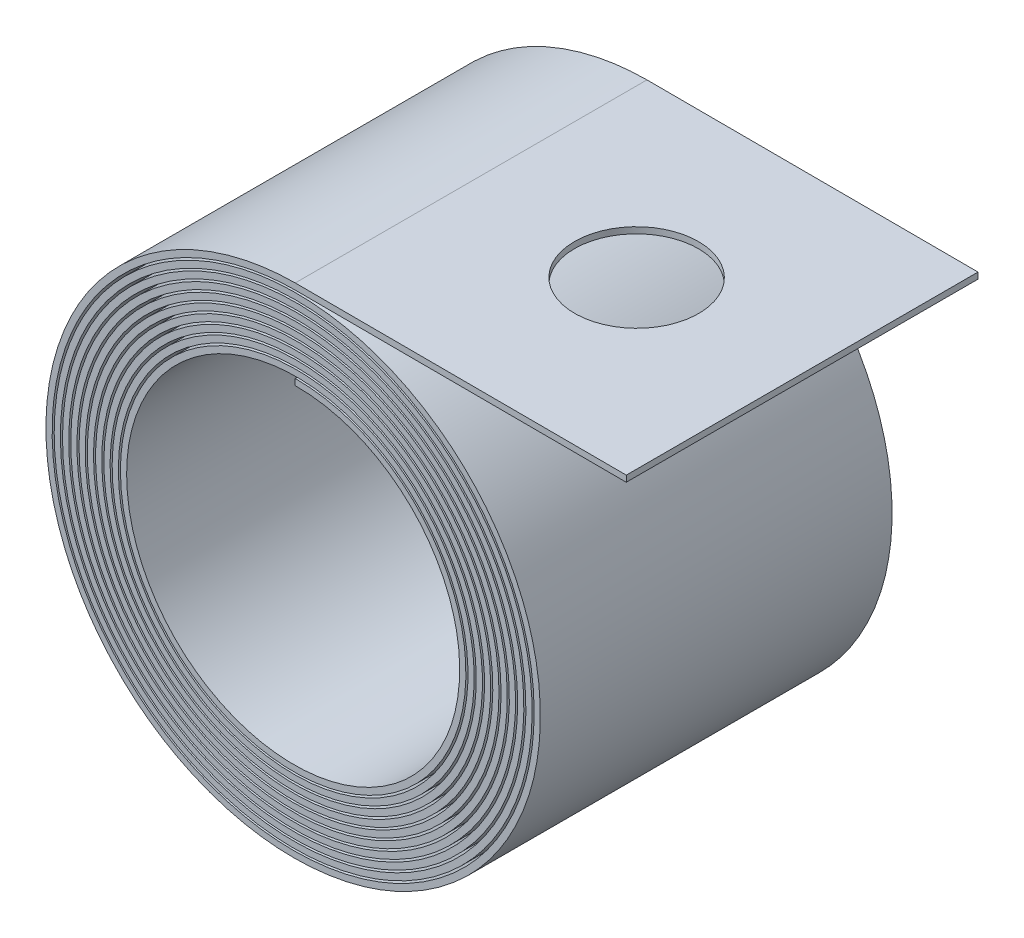
from build123d import *

# Parameters (mm, degrees)
SWEEP_START         = -4.25
SWEEP_1_DEPTH       = 8.5
SKETCH_5_W          = 8.5
SKETCH_5_H          = 0.15
EXTRUDE_2_DEPTH     = 8
SKETCH_6_R          = 1.5
CUT_EXTRUDE_1_DEPTH = 0.15


# Read off the part's stored shape, not the designer's step: 扫描1
with BuildPart() as part:
    # 扫描1 outline → 扫描1 (new body)
    with BuildSketch(Plane.XY.offset(SWEEP_START)):
        with BuildLine():
            Line((0, 4.075), (0, 3.925))
            add(Edge.make_bspline(
                [(0, 3.925), (0.642226637, 3.93020833), (1.286494802, 3.774676224), (2.42870073, 3.175965741), (2.925528499, 2.733324325), (3.653474808, 1.662625143), (3.883865128, 1.035568098), (4.021633544, -0.25694444), (3.928840666, -0.921169227), (3.439098606, -2.130731146), (3.04258066, -2.674897775), (2.036530571, -3.514017167), (1.427934296, -3.808137818), (0.140104167, -4.074923873), (-0.537907272, -4.047295631), (-1.804327217, -3.674016702), (-2.391514545, -3.328684705), (-3.336050383, -2.398880223), (-3.69246868, -1.815267916), (-4.088652425, -0.545109366), (-4.128001563, 0.140235088), (-3.877658288, 1.452189666), (-3.588166195, 2.077538862), (-2.745688207, 3.12052111), (-2.193476478, 3.537132772), (-0.954094753, 4.061776383), (-0.268093509, 4.169270616), (1.077347524, 4.047223284), (1.735498218, 3.817758921), (2.868790088, 3.073045491), (3.34282671, 2.558474902), (3.993655808, 1.362956702), (4.169791679, 0.683132452), (4.180208321, -0.683132452), (4.014439567, -1.368267978), (3.377163029, -2.582625922), (2.906229108, -3.11066966), (1.767505477, -3.884068454), (1.100781564, -4.128651805), (-0.273149335, -4.274439231), (-0.979047726, -4.175464656), (-2.264194363, -3.654414382), (-2.842199798, -3.232799866), (-3.733220371, -2.163508007), (-4.045353743, -1.516827031), (-4.328100589, -0.148756593), (-4.298405145, 0.571333692), (-3.901377357, 1.916043136), (-3.534386419, 2.53936622), (-2.546731899, 3.541752098), (-1.926983834, 3.919829333), (-0.578535786, 4.33976194), (0.148887514, 4.381178278), (1.541082401, 4.114874214), (2.204516298, 3.807369398), (3.310740317, 2.912990231), (3.752448546, 2.326939695), (4.308400375, 1.011973252), (4.422076301, 0.284298404), (4.292009962, -1.142560989), (4.048352565, -1.840378551), (3.258186653, -3.041694872), (2.712400094, -3.544023998), (1.444729879, -4.233419152), (0.724038607, -4.419791678), (-0.724038607, -4.430208322), (-1.450041154, -4.254202911), (-2.736551115, -3.578360318), (-3.295810821, -3.07913389), (-4.114662099, -1.872385812), (-4.373438481, -1.165995029), (-4.527244918, 0.28935423), (-4.422088646, 1.036926225), (-3.869730158, 2.397657581), (-3.423019072, 3.009501821), (-2.290485444, 3.952423574), (-1.605719766, 4.282569667), (-0.15740902, 4.581277304), (0.604760112, 4.549514658), (2.027759055, 4.128738012), (2.687217896, 3.740088133), (3.747453813, 2.694583576), (4.147189987, 2.038699753), (4.590871454, 0.611962206), (4.634354992, -0.15753994), (4.35209014, -1.629975136), (4.026572601, -2.331493733), (3.080292255, -3.500959523), (2.460402912, -3.967764321), (1.069851751, -4.555024366), (0.3005033, -4.674881986), (-1.207774455, -4.53679664), (-1.945258884, -4.27894621), (-3.214599655, -3.443327815), (-3.745221286, -2.866325285), (-4.473182497, -1.526503056), (-4.669791678, -0.764944762), (-4.680208322, 0.764944762), (-4.493966254, 1.531814331), (-3.779557607, 2.890476307), (-3.252038673, 3.480951981), (-1.977266146, 4.345255745), (-1.231208495, 4.618225158), (0.305559126, 4.780050604), (1.094804723, 4.668712637), (2.531120798, 4.085045934), (3.176803844, 3.613238278), (4.171626778, 2.41746288), (4.519785592, 1.6946125), (4.83445402, 0.166061446), (4.800624171, -0.638186532), (4.356098666, -2.139474974), (3.945789847, -2.835069571), (2.842435252, -3.953155528), (2.150415671, -4.37455064), (0.645388627, -4.841980968), (-0.166192366, -4.887531706), (-1.718867871, -4.589306066), (-2.458471169, -4.245775803), (-3.69117873, -3.247594279), (-4.183080096, -2.593866129), (-4.801648357, -1.127730251), (-4.927687672, -0.316708195), (-4.781583318, 1.27298792), (-4.509539854, 2.050139218), (-3.628468976, 3.387504438), (-3.020250477, 3.946418573), (-1.608276233, 4.712945841), (-0.805850916, 4.919791677), (0.805850916, 4.930208323), (1.613587507, 4.733729597), (3.044401499, 3.980754896), (3.666093142, 3.424943455), (4.57584939, 2.08214648), (4.863011835, 1.29642196), (5.032856291, -0.321764021), (4.915336627, -1.152683222), (4.30036171, -2.664584016), (3.803457483, -3.344105868), (2.544440316, -4.390829981), (1.783505235, -4.757001516), (0.174713872, -5.087630736), (-0.671612951, -5.051733684), (-2.251190893, -4.583459321), (-2.982921247, -4.151491562), (-4.158857243, -2.990286928), (-4.601911294, -2.26213159), (-5.093090483, -0.678815047), (-5.140708421, 0.174844792), (-4.826521991, 1.807760606), (-4.464979006, 2.585448604), (-3.414896303, 3.881397936), (-2.727329346, 4.398395871), (-1.18560875, 5.048272349), (-0.33291309, 5.180493357), (1.338201386, 5.026369996), (2.155019551, 4.740133499), (3.560409221, 3.813610138), (4.147615861, 3.174175669), (4.952709185, 1.69004941), (5.169791677, 0.846757071), (5.180208323, -0.846757071), (4.973492941, -1.695360683), (4.181952185, -3.198326691), (3.597848238, -3.851234303), (2.187026814, -4.806443035), (1.361635425, -5.107798512), (-0.337968916, -5.285661977), (-1.210561721, -5.161960617), (-2.798047233, -4.515677486), (-3.511407891, -3.993676689), (-4.610033185, -2.671417752), (-4.994217441, -1.87239797), (-5.340807451, -0.183366299), (-5.302843198, 0.705039371), (-4.810819976, 2.362906812), (-4.357193276, 3.130772923), (-3.138138605, 4.364558958), (-2.373847508, 4.829271947), (-0.712241467, 5.344199997), (0.183497218, 5.393885135), (1.896653341, 5.063737917), (2.71242604, 4.684182209), (4.071617143, 3.582198327), (4.613711646, 2.860792563), (5.29489634, 1.243487249), (5.433299043, 0.349117985), (5.271156674, -1.403414851), (4.970727143, -2.259899885), (3.9987513, -3.733314004), (3.32810086, -4.348813149), (1.771822586, -5.19247253), (0.887663226, -5.419791676), (-0.887663226, -5.430208324), (-1.77713386, -5.213256284), (-3.352251883, -4.383149473), (-4.036375464, -3.77075302), (-5.037036681, -2.291907148), (-5.352585189, -1.42684889), (-5.538467664, 0.354173811), (-5.408584608, 1.26844022), (-4.730993262, 2.93151045), (-4.183895895, 3.678709914), (-2.798395189, 4.829236388), (-1.961290704, 5.231433366), (-0.192018725, 5.593984166), (0.738465791, 5.553952711), (2.47462273, 5.03818063), (3.278624598, 4.56289499), (4.570260673, 3.285990281), (5.056632601, 2.485563427), (5.595309511, 0.745667887), (5.64706185, -0.192149644), (5.300953843, -1.985546075), (4.903385411, -2.839403475), (3.749500351, -4.261836349), (2.99425578, -4.829027421), (1.301365748, -5.541520331), (0.365322881, -5.686104728), (-1.468628316, -5.515943351), (-2.364780218, -5.201320788), (-3.906218787, -4.183892461), (-4.550010437, -3.482026052), (-5.432235874, -1.853595763), (-5.669791676, -0.92856938), (-5.680208324, 0.92856938), (-5.453019628, 1.858907036), (-4.584346762, 3.506177075), (-3.943657803, 4.221516625), (-2.396787482, 5.267630326), (-1.492062356, 5.597371866), (0.370378706, 5.79127335), (1.326318719, 5.655208598), (3.064973667, 4.946309038), (3.846011937, 4.374115101), (5.048439592, 2.925372625), (5.468649291, 2.050183439), (5.847160882, 0.200671151), (5.805062225, -0.771892211), (5.265541284, -2.586338649), (4.768596704, -3.426476274), (3.433841957, -4.775962388), (2.597279345, -5.283993255), (0.779094307, -5.846419025), (-0.20080207, -5.900238564), (-2.07443881, -5.538169768), (-2.966380911, -5.122588614), (-4.452055555, -3.916802375), (-5.044343197, -3.127718997), (-5.788144322, -1.359244248), (-5.938910414, -0.381527776), (-5.760730029, 1.533841782), (-5.431914432, 2.469660552), (-4.369033623, 4.07912357), (-3.635951243, 4.751207725), (-1.93536894, 5.671999218), (-0.969475867, 5.919791664), (0, 5.925)],
                knots=[0, 0, 0, 0, 0.0078125, 0.0078125, 0.015625, 0.015625, 0.0234375, 0.0234375, 0.03125, 0.03125, 0.0390625, 0.0390625, 0.046875, 0.046875, 0.0546875, 0.0546875, 0.0625, 0.0625, 0.0703125, 0.0703125, 0.078125, 0.078125, 0.0859375, 0.0859375, 0.09375, 0.09375, 0.1015625, 0.1015625, 0.109375, 0.109375, 0.1171875, 0.1171875, 0.125, 0.125, 0.1328125, 0.1328125, 0.140625, 0.140625, 0.1484375, 0.1484375, 0.15625, 0.15625, 0.1640625, 0.1640625, 0.171875, 0.171875, 0.1796875, 0.1796875, 0.1875, 0.1875, 0.1953125, 0.1953125, 0.203125, 0.203125, 0.2109375, 0.2109375, 0.21875, 0.21875, 0.2265625, 0.2265625, 0.234375, 0.234375, 0.2421875, 0.2421875, 0.25, 0.25, 0.2578125, 0.2578125, 0.265625, 0.265625, 0.2734375, 0.2734375, 0.28125, 0.28125, 0.2890625, 0.2890625, 0.296875, 0.296875, 0.3046875, 0.3046875, 0.3125, 0.3125, 0.3203125, 0.3203125, 0.328125, 0.328125, 0.3359375, 0.3359375, 0.34375, 0.34375, 0.3515625, 0.3515625, 0.359375, 0.359375, 0.3671875, 0.3671875, 0.375, 0.375, 0.3828125, 0.3828125, 0.390625, 0.390625, 0.3984375, 0.3984375, 0.40625, 0.40625, 0.4140625, 0.4140625, 0.421875, 0.421875, 0.4296875, 0.4296875, 0.4375, 0.4375, 0.4453125, 0.4453125, 0.453125, 0.453125, 0.4609375, 0.4609375, 0.46875, 0.46875, 0.4765625, 0.4765625, 0.484375, 0.484375, 0.4921875, 0.4921875, 0.5, 0.5, 0.5078125, 0.5078125, 0.515625, 0.515625, 0.5234375, 0.5234375, 0.53125, 0.53125, 0.5390625, 0.5390625, 0.546875, 0.546875, 0.5546875, 0.5546875, 0.5625, 0.5625, 0.5703125, 0.5703125, 0.578125, 0.578125, 0.5859375, 0.5859375, 0.59375, 0.59375, 0.6015625, 0.6015625, 0.609375, 0.609375, 0.6171875, 0.6171875, 0.625, 0.625, 0.6328125, 0.6328125, 0.640625, 0.640625, 0.6484375, 0.6484375, 0.65625, 0.65625, 0.6640625, 0.6640625, 0.671875, 0.671875, 0.6796875, 0.6796875, 0.6875, 0.6875, 0.6953125, 0.6953125, 0.703125, 0.703125, 0.7109375, 0.7109375, 0.71875, 0.71875, 0.7265625, 0.7265625, 0.734375, 0.734375, 0.7421875, 0.7421875, 0.75, 0.75, 0.7578125, 0.7578125, 0.765625, 0.765625, 0.7734375, 0.7734375, 0.78125, 0.78125, 0.7890625, 0.7890625, 0.796875, 0.796875, 0.8046875, 0.8046875, 0.8125, 0.8125, 0.8203125, 0.8203125, 0.828125, 0.828125, 0.8359375, 0.8359375, 0.84375, 0.84375, 0.8515625, 0.8515625, 0.859375, 0.859375, 0.8671875, 0.8671875, 0.875, 0.875, 0.8828125, 0.8828125, 0.890625, 0.890625, 0.8984375, 0.8984375, 0.90625, 0.90625, 0.9140625, 0.9140625, 0.921875, 0.921875, 0.9296875, 0.9296875, 0.9375, 0.9375, 0.9453125, 0.9453125, 0.953125, 0.953125, 0.9609375, 0.9609375, 0.96875, 0.96875, 0.9765625, 0.9765625, 0.984375, 0.984375, 0.9921875, 0.9921875, 1, 1, 1, 1], degree=3))
            Line((0, 5.925), (0.000410604, 6.074999438))
            add(Edge.make_bspline(
                [(0, 4.075), (0.667256163, 4.08020833), (1.335138249, 3.918759884), (2.521484812, 3.296453913), (3.036352084, 2.837460863), (3.792102782, 1.725143698), (4.030693682, 1.075161792), (4.173363221, -0.267161564), (4.076995147, -0.95546987), (3.56809339, -2.211270761), (3.15706891, -2.774991354), (2.112323603, -3.645856841), (1.481715724, -3.950383526), (0.144794172, -4.226924816), (-0.557535084, -4.198096931), (-1.871847921, -3.810278351), (-2.479915744, -3.452424393), (-3.459834306, -2.487219468), (-3.828764102, -1.882720416), (-4.239463519, -0.564661742), (-4.280000138, 0.145001076), (-4.019877113, 1.506042121), (-3.719968037, 2.153397648), (-2.84572474, 3.235059193), (-2.273951924, 3.666167585), (-0.988321855, 4.209947857), (-0.278235471, 4.32100532), (1.117013755, 4.19403224), (1.798085087, 3.956356047), (2.972981058, 3.183817875), (3.463360314, 2.651199923), (4.137763177, 1.41152979), (4.319803814, 0.708085168), (4.330196151, -0.708230844), (4.158499699, -1.416980982), (3.497606551, -2.675467917), (3.010312515, -3.221543111), (1.829957862, -4.022726223), (1.14030543, -4.275499145), (-0.28343831, -4.426164028), (-1.013418271, -4.323602911), (-2.34479458, -3.78337128), (-2.942346966, -3.347241211), (-3.865095361, -2.239239526), (-4.187624409, -1.570542333), (-4.480103663, -0.153376234), (-4.449197351, 0.591031061), (-4.037607949, 1.983626427), (-3.658085603, 2.627824048), (-2.635014675, 3.665576273), (-1.994374383, 4.056155372), (-0.598019897, 4.490581845), (0.153722058, 4.533174665), (1.594998736, 4.257068809), (2.280434072, 3.939137246), (3.425322983, 3.012975662), (3.881519092, 2.407357779), (4.456586964, 1.046134755), (4.573815443, 0.29437343), (4.438801453, -1.182291723), (4.186922252, -1.903026097), (3.368913561, -3.145934137), (2.805072697, -3.664597881), (1.493240551, -4.377547522), (0.74892658, -4.569814547), (-0.749201472, -4.580185327), (-1.498815865, -4.39824214), (-2.829444493, -3.698764188), (-3.406728516, -3.183170117), (-4.2533463, -1.93477943), (-4.520302479, -1.205456878), (-4.678965353, 0.299707031), (-4.570212459, 1.071358868), (-3.998653363, 2.478311642), (-3.537418705, 3.109696604), (-2.366162258, 4.084329943), (-1.659376257, 4.424862503), (-0.161966071, 4.733282249), (0.624519356, 4.700298749), (2.095398029, 4.264940944), (2.775726107, 3.863751248), (3.871313802, 2.782816065), (4.283543263, 2.106035131), (4.741699183, 0.631385516), (4.786349406, -0.162435548), (4.494263124, -1.68394838), (4.158310135, -2.407464061), (3.180232119, -3.615581911), (2.540769846, -4.0968667), (1.103954753, -4.703224411), (0.310518626, -4.826625063), (-1.247562724, -4.683572528), (-2.007960557, -4.417491393), (-3.318882006, -3.554014121), (-3.865831103, -2.958951087), (-4.617329594, -1.574957996), (-4.819824108, -0.78977492), (-4.830175638, 0.79016521), (-4.63798679, 1.580644156), (-3.89992603, 2.983415584), (-3.356032721, 3.5919092), (-2.039607225, 4.483963552), (-1.270614894, 4.765104026), (0.315968999, 4.931767117), (1.129292899, 4.816823512), (2.611823017, 4.21393898), (3.277041213, 3.727600577), (4.303561209, 2.493090727), (4.662098251, 1.748216347), (4.986460618, 0.170562462), (4.951400976, -0.658001174), (4.492276808, -2.207163809), (4.069420638, -2.923622901), (2.930622675, -4.077047589), (2.217701604, -4.510928305), (0.664757437, -4.99281569), (-0.171142711, -5.039524332), (-1.772892134, -4.731459654), (-2.534488613, -4.377486137), (-3.805836732, -3.347493259), (-4.312211015, -2.674187168), (-4.949860457, -1.161780754), (-5.079434259, -0.326669947), (-4.928345182, 1.312827829), (-4.648063024, 2.112889474), (-3.739118811, 3.491825465), (-3.112834238, 4.067060647), (-1.656681104, 4.857109744), (-0.830629133, 5.06983268), (0.831123105, 5.080166913), (1.662466858, 4.877733318), (3.137382024, 4.10109144), (3.777085879, 3.528899573), (4.714578409, 2.144440307), (5.009904059, 1.335778487), (5.184569259, -0.332225234), (5.063435847, -1.187221354), (4.429227603, -2.74532956), (3.91778617, -3.444381551), (2.620024075, -4.522789659), (1.837061681, -4.899332006), (0.179164429, -5.239638806), (-0.691477483, -5.202503911), (-2.318924636, -4.719615117), (-3.071515214, -4.275093219), (-4.28277819, -3.078433733), (-4.738310924, -2.329372956), (-5.243931492, -0.69813473), (-5.292699418, 0.179844482), (-4.968658077, 1.861830867), (-4.596664797, 2.66150853), (-3.514758395, 3.996088051), (-2.807608975, 4.527552524), (-1.219611881, 5.196495311), (-0.342826495, 5.332243098), (1.378087901, 5.173119187), (2.217813657, 4.878636782), (3.664765159, 3.924227032), (4.26828705, 3.266721458), (5.096888253, 1.738409054), (5.319840408, 0.871488367), (5.330159016, -0.872076003), (5.117481452, -1.74428478), (4.302259907, -3.291344487), (3.701770062, -3.962259133), (2.249277917, -4.945191218), (1.400946857, -5.254702799), (-0.348476556, -5.437371725), (-1.245145032, -5.310049282), (-2.878831963, -4.644518803), (-3.61171823, -4.107974956), (-4.742015696, -2.746961609), (-5.136564054, -1.925911513), (-5.49281684, -0.187771179), (-5.453607456, 0.724949065), (-4.946955525, 2.430681212), (-4.480768539, 3.219403682), (-3.226248612, 4.488506058), (-2.441048498, 4.965691462), (-0.731516638, 5.495046689), (0.188541621, 5.545874644), (1.950765286, 5.205858126), (2.788524465, 4.815845743), (4.18633636, 3.682026968), (4.742891619, 2.941034641), (5.44312914, 1.277447418), (5.585051631, 0.358987542), (5.417894357, -1.443343641), (5.109212375, -2.322733766), (4.109338294, -3.837701611), (3.420612184, -4.46951075), (1.820141176, -5.33666535), (0.912351927, -5.569847411), (-0.913024596, -5.580151834), (-1.826098582, -5.357230975), (-3.44530352, -4.50343101), (-4.147429435, -3.874643688), (-5.175802262, -2.354119432), (-5.499500424, -1.466119349), (-5.690174473, 0.36472364), (-5.556663668, 1.303064586), (-4.859812231, 3.012330794), (-4.298166499, 3.779051749), (-2.873902759, 4.961239651), (-2.014765232, 5.37379463), (-0.196382063, 5.745994744), (0.758416562, 5.704711529), (2.542434113, 5.174297751), (3.367288825, 4.686446231), (4.694231563, 3.374066795), (5.193070202, 2.552727666), (5.746161366, 0.764902539), (5.799049993, -0.19723475), (5.443059587, -2.039695971), (5.03502867, -2.915536951), (3.84929852, -4.376582064), (3.074463649, -4.958228627), (1.335286776, -5.689762084), (0.375152486, -5.837859901), (-1.508595627, -5.662670538), (-2.427650344, -5.339789559), (-4.010635253, -4.294452195), (-4.670732106, -3.574505951), (-5.576441224, -1.901876919), (-5.819853787, -0.953219242), (-5.830145275, 0.953969452), (-5.596981703, 1.907908808), (-4.704604404, 3.599259577), (-4.047520039, 4.332597174), (-2.458964342, 5.406411774), (-1.531295421, 5.744297082), (0.38096704, 5.942977468), (1.360980558, 5.803278883), (3.145826519, 5.075107596), (3.946382522, 4.488360442), (5.180461796, 3.000847055), (5.611023926, 2.103622332), (5.999172535, 0.204996544), (5.955816064, -0.791880504), (5.40164156, -2.654183816), (4.892125988, -3.515171076), (3.521887858, -4.899955012), (2.664409993, -5.420447378), (0.798291919, -5.99727559), (-0.205924385, -6.05222545), (-2.128623402, -5.680262278), (-3.042546434, -5.254213325), (-4.566825498, -4.016572669), (-5.173563814, -3.207895572), (-5.936394256, -1.393129467), (-6.090667941, -0.391320832), (-5.907447603, 1.573844336), (-5.570368133, 2.53256384), (-4.4795684, 4.183566444), (-3.728402375, 4.871951417), (-1.983615824, 5.81621603), (-0.994088609, 6.0698596), (0.000410604, 6.074999438)],
                knots=[0, 0, 0, 0, 0.0078125, 0.0078125, 0.015625, 0.015625, 0.0234375, 0.0234375, 0.03125, 0.03125, 0.0390625, 0.0390625, 0.046875, 0.046875, 0.0546875, 0.0546875, 0.0625, 0.0625, 0.0703125, 0.0703125, 0.078125, 0.078125, 0.0859375, 0.0859375, 0.09375, 0.09375, 0.1015625, 0.1015625, 0.109375, 0.109375, 0.1171875, 0.1171875, 0.125, 0.125, 0.1328125, 0.1328125, 0.140625, 0.140625, 0.1484375, 0.1484375, 0.15625, 0.15625, 0.1640625, 0.1640625, 0.171875, 0.171875, 0.1796875, 0.1796875, 0.1875, 0.1875, 0.1953125, 0.1953125, 0.203125, 0.203125, 0.2109375, 0.2109375, 0.21875, 0.21875, 0.2265625, 0.2265625, 0.234375, 0.234375, 0.2421875, 0.2421875, 0.25, 0.25, 0.2578125, 0.2578125, 0.265625, 0.265625, 0.2734375, 0.2734375, 0.28125, 0.28125, 0.2890625, 0.2890625, 0.296875, 0.296875, 0.3046875, 0.3046875, 0.3125, 0.3125, 0.3203125, 0.3203125, 0.328125, 0.328125, 0.3359375, 0.3359375, 0.34375, 0.34375, 0.3515625, 0.3515625, 0.359375, 0.359375, 0.3671875, 0.3671875, 0.375, 0.375, 0.3828125, 0.3828125, 0.390625, 0.390625, 0.3984375, 0.3984375, 0.40625, 0.40625, 0.4140625, 0.4140625, 0.421875, 0.421875, 0.4296875, 0.4296875, 0.4375, 0.4375, 0.4453125, 0.4453125, 0.453125, 0.453125, 0.4609375, 0.4609375, 0.46875, 0.46875, 0.4765625, 0.4765625, 0.484375, 0.484375, 0.4921875, 0.4921875, 0.5, 0.5, 0.5078125, 0.5078125, 0.515625, 0.515625, 0.5234375, 0.5234375, 0.53125, 0.53125, 0.5390625, 0.5390625, 0.546875, 0.546875, 0.5546875, 0.5546875, 0.5625, 0.5625, 0.5703125, 0.5703125, 0.578125, 0.578125, 0.5859375, 0.5859375, 0.59375, 0.59375, 0.6015625, 0.6015625, 0.609375, 0.609375, 0.6171875, 0.6171875, 0.625, 0.625, 0.6328125, 0.6328125, 0.640625, 0.640625, 0.6484375, 0.6484375, 0.65625, 0.65625, 0.6640625, 0.6640625, 0.671875, 0.671875, 0.6796875, 0.6796875, 0.6875, 0.6875, 0.6953125, 0.6953125, 0.703125, 0.703125, 0.7109375, 0.7109375, 0.71875, 0.71875, 0.7265625, 0.7265625, 0.734375, 0.734375, 0.7421875, 0.7421875, 0.75, 0.75, 0.7578125, 0.7578125, 0.765625, 0.765625, 0.7734375, 0.7734375, 0.78125, 0.78125, 0.7890625, 0.7890625, 0.796875, 0.796875, 0.8046875, 0.8046875, 0.8125, 0.8125, 0.8203125, 0.8203125, 0.828125, 0.828125, 0.8359375, 0.8359375, 0.84375, 0.84375, 0.8515625, 0.8515625, 0.859375, 0.859375, 0.8671875, 0.8671875, 0.875, 0.875, 0.8828125, 0.8828125, 0.890625, 0.890625, 0.8984375, 0.8984375, 0.90625, 0.90625, 0.9140625, 0.9140625, 0.921875, 0.921875, 0.9296875, 0.9296875, 0.9375, 0.9375, 0.9453125, 0.9453125, 0.953125, 0.953125, 0.9609375, 0.9609375, 0.96875, 0.96875, 0.9765625, 0.9765625, 0.984375, 0.984375, 0.9921875, 0.9921875, 1, 1, 1, 1], degree=3))
        make_face()
    extrude(amount=SWEEP_1_DEPTH)

    # 草图5 → 凸台-拉伸2 (add)
    with BuildSketch(Plane(origin=(-0.016218784, 4.4397e-05, 0), x_dir=(0, 0, -1), z_dir=(0.9999962534292708, -0.0027373577446042725, 0))):
        with Locations((0, 5.999977802)):
            Rectangle(SKETCH_5_W, SKETCH_5_H)
    extrude(amount=EXTRUDE_2_DEPTH)

    # 草图6 → 切除-拉伸1 (cut)
    with BuildSketch(Plane(origin=(0.016629388, 6.074955041, 0), x_dir=(0.9999962534292707, -0.002737357744604273, 0), z_dir=(0.0027373577446042734, 0.9999962534292708, 0))):
        with Locations(Location((3.983781155, 0, 0), (0, 0, 180))):
            Circle(SKETCH_6_R)
    extrude(amount=-CUT_EXTRUDE_1_DEPTH, mode=Mode.SUBTRACT)


solid = part.part
